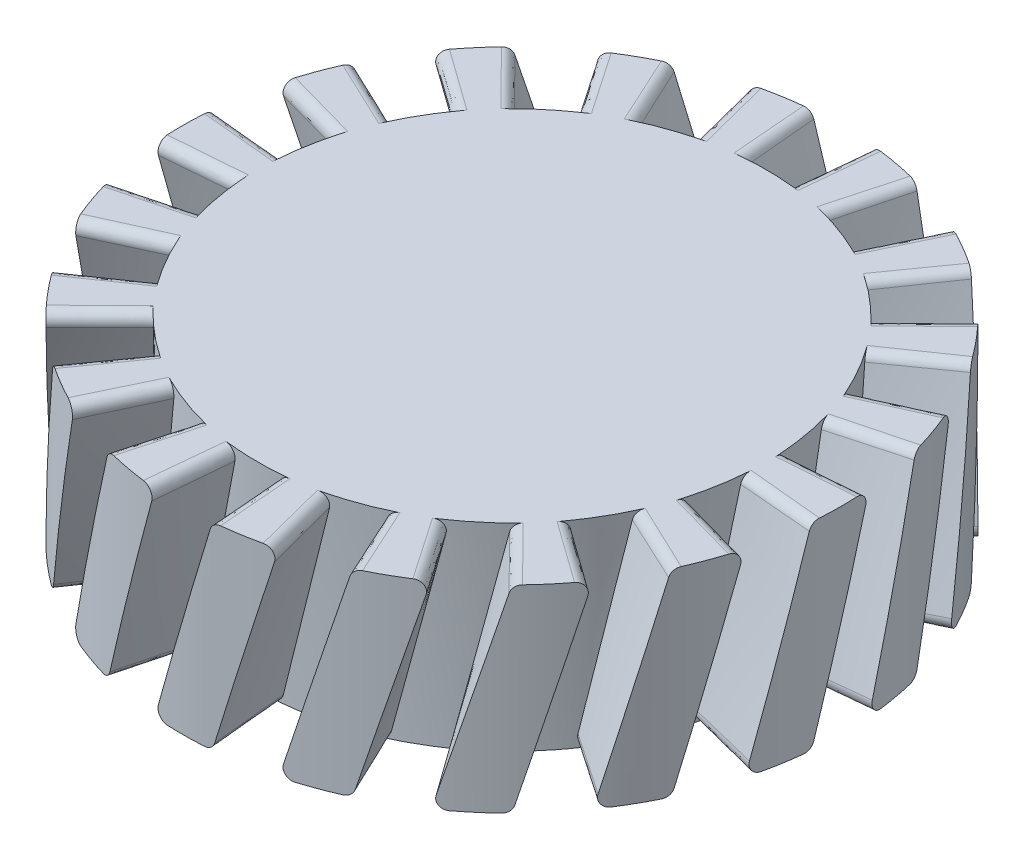
from build123d import *

# Parameters (mm, degrees)
SKETCH1_R                = 50
BOSS_EXTRUDE1_DEPTH      = 30
SKETCH2_R                = 23.5
CUT_EXTRUDE1_DEPTH       = 15
FILLET2_R                = 1.5
CIRPATTERN3_COUNT        = 18
FILLET2_OF_CIRPATTERN3_R = 1.5


with BuildPart() as part:
    # Sketch1 → Boss-Extrude1 (new body)
    with BuildSketch(Plane(origin=(0, 0, 0), x_dir=(1, 0, 0), z_dir=(0, 1, 0))):
        Circle(SKETCH1_R)
    extrude(amount=BOSS_EXTRUDE1_DEPTH)

    # Sketch2 → Cut-Extrude1 (cut)
    with BuildSketch(Plane(origin=(0, 0, 0), x_dir=(1, 0, 0), z_dir=(0, 1, 0))):
        Circle(SKETCH2_R)
    extrude(amount=CUT_EXTRUDE1_DEPTH, mode=Mode.SUBTRACT)

    # Sketch4 for Cut-Loft1 → Cut-Loft1 section 0
    with BuildSketch(Plane(origin=(0, 0, 0), x_dir=(1, 0, 0), z_dir=(0, 1, 0))):
        with BuildLine():
            Line((38.353495877, 3.355496096), (50.805929603, 4.44494288))
            # circular arc as an exact rational Bezier (weights 1, cos(half-angle), 1)
            Bezier((50.805929603, 4.44494288), (51.194811715, 0), (50.805929603, -4.44494288), weights=[1, 0.996194698, 1])
            Line((50.805929603, -4.44494288), (38.353495877, -3.355496096))
            Bezier((38.353495877, -3.355496096), (38.647063745, 0), (38.353495877, 3.355496096), weights=[1, 0.996194698, 1])
        make_face()
    # Sketch7 for Cut-Loft1 → Cut-Loft1 section 1
    with BuildSketch(Plane(origin=(0, 30, 0), x_dir=(1, 0, 0), z_dir=(0, 1, 0))):
        with BuildLine():
            Line((37.188144312, 9.964533236), (49.262217141, 13.1997713))
            Bezier((49.262217141, 13.1997713), (50.417047491, 8.88988576), (50.805929603, 4.44494288), weights=[1, 0.996194698, 1])
            Line((50.805929603, 4.44494288), (38.353495877, 3.355496096))
            Bezier((38.353495877, 3.355496096), (38.059928008, 6.710992192), (37.188144312, 9.964533236), weights=[1, 0.996194698, 1])
        make_face()
    cut_loft1 = loft(mode=Mode.SUBTRACT)

    # Fillet2
    fillet2_edges = [part.edges().sort_by_distance(p)[0] for p in [
        (44.081615391, 30, -3.856641617),
        (42.742217813, 30, -11.452742746),
        (44.081615391, 0, 3.856641617),
        (44.081615391, 0, -3.856641617),
    ]]
    fillet(fillet2_edges, radius=FILLET2_R)

    # CirPattern3: Cut-Loft1 ×18 about axis
    cirpattern3_axis = Axis((0, -0.7, 0), (0, 1, 0))
    for i in range(1, CIRPATTERN3_COUNT):
        add(cut_loft1.rotate(cirpattern3_axis, i * 360 / CIRPATTERN3_COUNT), mode=Mode.SUBTRACT)

    # Fillet2 of CirPattern3
    fillet2_of_cirpattern3_edges = [part.edges().sort_by_distance(p)[0] for p in [
        (40.104119576, 30, -18.700858082),
        (36.24747796, 30, -25.380757309),
        (42.742217813, 0, -11.452742746),
        (40.104119576, 0, -18.700858082),
        (31.289475068, 30, -31.289475068),
        (25.380757309, 30, -36.24747796),
        (36.24747796, 0, -25.380757309),
        (31.289475068, 0, -31.289475068),
        (18.700858082, 30, -40.104119576),
        (11.452742746, 30, -42.742217813),
        (25.380757309, 0, -36.24747796),
        (18.700858082, 0, -40.104119576),
        (3.856641617, 30, -44.081615391),
        (-3.856641617, 30, -44.081615391),
        (11.452742746, 0, -42.742217813),
        (3.856641617, 0, -44.081615391),
        (-11.452742746, 30, -42.742217813),
        (-18.700858082, 30, -40.104119576),
        (-3.856641617, 0, -44.081615391),
        (-11.452742746, 0, -42.742217813),
        (-25.380757309, 30, -36.24747796),
        (-31.289475068, 30, -31.289475068),
        (-18.700858082, 0, -40.104119576),
        (-25.380757309, 0, -36.24747796),
        (-36.24747796, 30, -25.380757309),
        (-40.104119576, 30, -18.700858082),
        (-31.289475068, 0, -31.289475068),
        (-36.24747796, 0, -25.380757309),
        (-42.742217813, 30, -11.452742746),
        (-44.081615391, 30, -3.856641617),
        (-40.104119576, 0, -18.700858082),
        (-42.742217813, 0, -11.452742746),
        (-44.081615391, 30, 3.856641617),
        (-42.742217813, 30, 11.452742746),
        (-44.081615391, 0, -3.856641617),
        (-44.081615391, 0, 3.856641617),
        (-40.104119576, 30, 18.700858082),
        (-36.24747796, 30, 25.380757309),
        (-42.742217813, 0, 11.452742746),
        (-40.104119576, 0, 18.700858082),
        (-31.289475068, 30, 31.289475068),
        (-25.380757309, 30, 36.24747796),
        (-36.24747796, 0, 25.380757309),
        (-31.289475068, 0, 31.289475068),
        (-18.700858082, 30, 40.104119576),
        (-11.452742746, 30, 42.742217813),
        (-25.380757309, 0, 36.24747796),
        (-18.700858082, 0, 40.104119576),
        (-3.856641617, 30, 44.081615391),
        (3.856641617, 30, 44.081615391),
        (-11.452742746, 0, 42.742217813),
        (-3.856641617, 0, 44.081615391),
        (11.452742746, 30, 42.742217813),
        (18.700858082, 30, 40.104119576),
        (3.856641617, 0, 44.081615391),
        (11.452742746, 0, 42.742217813),
        (25.380757309, 30, 36.24747796),
        (31.289475068, 30, 31.289475068),
        (18.700858082, 0, 40.104119576),
        (25.380757309, 0, 36.24747796),
        (36.24747796, 30, 25.380757309),
        (40.104119576, 30, 18.700858082),
        (31.289475068, 0, 31.289475068),
        (36.24747796, 0, 25.380757309),
        (42.742217813, 30, 11.452742746),
        (44.081615391, 30, 3.856641617),
        (40.104119576, 0, 18.700858082),
        (42.742217813, 0, 11.452742746),
    ]]
    fillet(fillet2_of_cirpattern3_edges, radius=FILLET2_OF_CIRPATTERN3_R)


solid = part.part
